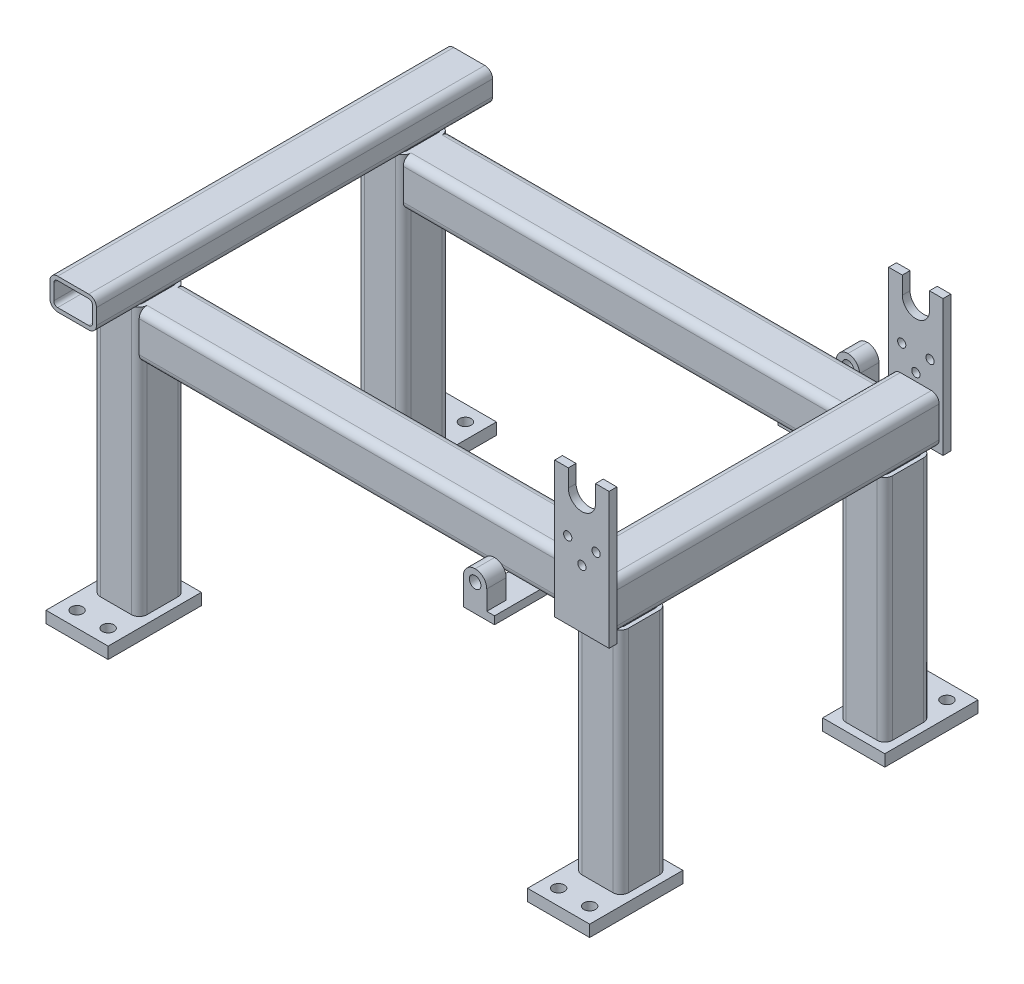
from build123d import *

# Parameters (mm, degrees)
BASE_EXTRUDE_THIN_DEPTH  = 266.7
SKETCH2_W                = 88.9
SKETCH2_H                = 222.25
BOSS_EXTRUDE1_DEPTH      = 12.7
BOSS_EXTRUDE_THIN1_DEPTH = 393.7
BOSS_EXTRUDE_THIN2_DEPTH = 711.2
SKETCH5_W                = 50.8
SKETCH5_H                = 127
BOSS_EXTRUDE3_DEPTH      = 12.7
SKETCH6_W                = 38.1
SKETCH6_H                = 31.75
BOSS_EXTRUDE4_DEPTH      = 50.8
FILLET1_R                = 19.05
CUT_EXTRUDE1_REACH       = 1035.203
SKETCH7_R                = 9.525
BOSS_EXTRUDE_THIN3_DEPTH = 457.2
BOSS_EXTRUDE_THIN4_DEPTH = 323.85
SKETCH10_W               = 101.6
SKETCH10_H               = 152.4
SKETCH10_R               = 9.525
BOSS_EXTRUDE6_DEPTH      = 19.05
SKETCH12_W               = 101.6
SKETCH12_H               = 152.4
SKETCH12_R               = 9.525
BOSS_EXTRUDE8_DEPTH      = 19.05
SKETCH13_R               = 6.7437
CUT_EXTRUDE2_DEPTH       = 1089.057259523
CUT_EXTRUDE3_DEPTH       = 1213.317946126


with BuildPart() as part:
    # Sketch1 → Base-Extrude-Thin (new body)
    with BuildSketch(Plane.XY):
        with BuildLine():
            Line((25.4, -165.1), (-25.4, -165.1))
            ThreePointArc((-25.4, -165.1), (-34.380256121, -168.819743879), (-38.1, -177.8))
            Line((-38.1, -177.8), (-38.1, -228.6))
            ThreePointArc((-38.1, -228.6), (-34.380256121, -237.580256121), (-25.4, -241.3))
            Line((-25.4, -241.3), (25.4, -241.3))
            ThreePointArc((25.4, -241.3), (34.380256121, -237.580256121), (38.1, -228.6))
            Line((38.1, -228.6), (38.1, -177.8))
            ThreePointArc((38.1, -177.8), (34.380256121, -168.819743879), (25.4, -165.1))
        make_face()
        with BuildLine():
            Line((25.4, -171.45), (-25.4, -171.45))
            ThreePointArc((-25.4, -171.45), (-29.890128061, -173.309871939), (-31.75, -177.8))
            Line((-31.75, -177.8), (-31.75, -228.6))
            ThreePointArc((-31.75, -228.6), (-29.890128061, -233.090128061), (-25.4, -234.95))
            Line((-25.4, -234.95), (25.4, -234.95))
            ThreePointArc((25.4, -234.95), (29.890128061, -233.090128061), (31.75, -228.6))
            Line((31.75, -228.6), (31.75, -177.8))
            ThreePointArc((31.75, -177.8), (29.890128061, -173.309871939), (25.4, -171.45))
        make_face(mode=Mode.SUBTRACT)
    extrude(amount=BASE_EXTRUDE_THIN_DEPTH)

    # Sketch2 → Boss-Extrude1 (add)
    with BuildSketch(Plane.XY.offset(266.7)):
        with Locations((0, -136.525)):
            Rectangle(SKETCH2_W, SKETCH2_H)
    extrude(amount=BOSS_EXTRUDE1_DEPTH)

    # Sketch3 → Boss-Extrude-Thin1 (add)
    with BuildSketch(Plane.XZ.offset(241.3)):
        with BuildLine():
            Line((25.4, 254), (-25.4, 254))
            ThreePointArc((-25.4, 254), (-34.380256121, 250.280256121), (-38.1, 241.3))
            Line((-38.1, 241.3), (-38.1, 190.5))
            ThreePointArc((-38.1, 190.5), (-34.380256121, 181.519743879), (-25.4, 177.8))
            Line((-25.4, 177.8), (25.4, 177.8))
            ThreePointArc((25.4, 177.8), (34.380256121, 181.519743879), (38.1, 190.5))
            Line((38.1, 190.5), (38.1, 241.3))
            ThreePointArc((38.1, 241.3), (34.380256121, 250.280256121), (25.4, 254))
        make_face()
        with BuildLine():
            Line((25.4, 247.65), (-25.4, 247.65))
            ThreePointArc((-25.4, 247.65), (-29.890128061, 245.790128061), (-31.75, 241.3))
            Line((-31.75, 241.3), (-31.75, 190.5))
            ThreePointArc((-31.75, 190.5), (-29.890128061, 186.009871939), (-25.4, 184.15))
            Line((-25.4, 184.15), (25.4, 184.15))
            ThreePointArc((25.4, 184.15), (29.890128061, 186.009871939), (31.75, 190.5))
            Line((31.75, 190.5), (31.75, 241.3))
            ThreePointArc((31.75, 241.3), (29.890128061, 245.790128061), (25.4, 247.65))
        make_face(mode=Mode.SUBTRACT)
    extrude(amount=BOSS_EXTRUDE_THIN1_DEPTH)

    # Sketch4 → Boss-Extrude-Thin2 (add)
    with BuildSketch(Plane(origin=(-38.1, 14.778510966, 30.648889912), x_dir=(0, 0, 1), z_dir=(-1, 0, 0))):
        with BuildLine():
            Line((210.651110088, -192.578510966), (159.851110088, -192.578510966))
            ThreePointArc((159.851110088, -192.578510966), (150.870853967, -196.298254845), (147.151110088, -205.278510966))
            Line((147.151110088, -205.278510966), (147.151110088, -256.078510966))
            ThreePointArc((147.151110088, -256.078510966), (150.870853967, -265.058767087), (159.851110088, -268.778510966))
            Line((159.851110088, -268.778510966), (210.651110088, -268.778510966))
            ThreePointArc((210.651110088, -268.778510966), (219.631366209, -265.058767087), (223.351110088, -256.078510966))
            Line((223.351110088, -256.078510966), (223.351110088, -205.278510966))
            ThreePointArc((223.351110088, -205.278510966), (219.631366209, -196.298254845), (210.651110088, -192.578510966))
        make_face()
        with BuildLine():
            Line((210.651110088, -198.928510966), (159.851110088, -198.928510966))
            ThreePointArc((159.851110088, -198.928510966), (155.360982027, -200.788382906), (153.501110088, -205.278510966))
            Line((153.501110088, -205.278510966), (153.501110088, -256.078510966))
            ThreePointArc((153.501110088, -256.078510966), (155.360982027, -260.568639027), (159.851110088, -262.428510966))
            Line((159.851110088, -262.428510966), (210.651110088, -262.428510966))
            ThreePointArc((210.651110088, -262.428510966), (215.141238148, -260.568639027), (217.001110088, -256.078510966))
            Line((217.001110088, -256.078510966), (217.001110088, -205.278510966))
            ThreePointArc((217.001110088, -205.278510966), (215.141238148, -200.788382906), (210.651110088, -198.928510966))
        make_face(mode=Mode.SUBTRACT)
    extrude(amount=BOSS_EXTRUDE_THIN2_DEPTH)

    # Sketch5 → Boss-Extrude3 (add)
    with BuildSketch(Plane.XZ.offset(254)):
        with Locations((-127, 257.175)):
            Rectangle(SKETCH5_W, SKETCH5_H)
    extrude(amount=BOSS_EXTRUDE3_DEPTH)

    # Sketch6 → Boss-Extrude4 (add)
    with BuildSketch(Plane(origin=(0, -254, 0), x_dir=(-1, 0, 0), z_dir=(0, 1, 0))):
        with Locations((133.35, 304.8)):
            Rectangle(SKETCH6_W, SKETCH6_H)
    extrude(amount=BOSS_EXTRUDE4_DEPTH)

    # Fillet1
    fillet1_edges = [part.edges().sort_by_distance(p)[0] for p in [
        (-114.3, -203.2, 304.8),
        (-152.4, -203.2, 304.8),
    ]]
    fillet(fillet1_edges, radius=FILLET1_R - 0.0001)  # a hair under: the kernel refuses the full size

    # Sketch7 → Cut-Extrude1 (cut, up to next)
    with BuildSketch(Plane.XY.offset(320.675), mode=Mode.PRIVATE) as cut_extrude1_sk1:
        with Locations((-133.35, -222.25)):
            Circle(SKETCH7_R)
    cut_extrude1_tool1 = extrude(cut_extrude1_sk1.sketch, amount=-CUT_EXTRUDE1_REACH, mode=Mode.PRIVATE) & part.part
    add(cut_extrude1_tool1.solids().sort_by_distance((-133.35, -222.25, 320.675))[0], mode=Mode.SUBTRACT)

    # Sketch8 → Boss-Extrude-Thin3 (add)
    with BuildSketch(Plane(origin=(0, -635, 0), x_dir=(-1, 0, 0), z_dir=(0, 1, 0))):
        with BuildLine():
            Line((812.8, 254), (762, 254))
            ThreePointArc((762, 254), (753.019743879, 250.280256121), (749.3, 241.3))
            Line((749.3, 241.3), (749.3, 190.5))
            ThreePointArc((749.3, 190.5), (753.019743879, 181.519743879), (762, 177.8))
            Line((762, 177.8), (812.8, 177.8))
            ThreePointArc((812.8, 177.8), (821.780256121, 181.519743879), (825.5, 190.5))
            Line((825.5, 190.5), (825.5, 241.3))
            ThreePointArc((825.5, 241.3), (821.780256121, 250.280256121), (812.8, 254))
        make_face()
        with BuildLine():
            Line((812.8, 247.65), (762, 247.65))
            ThreePointArc((762, 247.65), (757.50987194, 245.790128061), (755.65, 241.3))
            Line((755.65, 241.3), (755.65, 190.5))
            ThreePointArc((755.65, 190.5), (757.50987194, 186.009871939), (762, 184.15))
            Line((762, 184.15), (812.8, 184.15))
            ThreePointArc((812.8, 184.15), (817.290128061, 186.009871939), (819.15, 190.5))
            Line((819.15, 190.5), (819.15, 241.3))
            ThreePointArc((819.15, 241.3), (817.290128061, 245.790128061), (812.8, 247.65))
        make_face(mode=Mode.SUBTRACT)
    extrude(amount=BOSS_EXTRUDE_THIN3_DEPTH)

    # Sketch9 → Boss-Extrude-Thin4 (add)
    with BuildSketch(Plane.XY):
        with BuildLine():
            Line((-762, -127), (-812.8, -127))
            ThreePointArc((-812.8, -127), (-821.780256121, -130.719743879), (-825.5, -139.7))
            Line((-825.5, -139.7), (-825.5, -165.1))
            ThreePointArc((-825.5, -165.1), (-821.780256121, -174.080256121), (-812.8, -177.8))
            Line((-812.8, -177.8), (-762, -177.8))
            ThreePointArc((-762, -177.8), (-753.019743879, -174.080256121), (-749.3, -165.1))
            Line((-749.3, -165.1), (-749.3, -139.7))
            ThreePointArc((-749.3, -139.7), (-753.019743879, -130.719743879), (-762, -127))
        make_face()
        with BuildLine():
            Line((-762, -133.35), (-812.8, -133.35))
            ThreePointArc((-812.8, -133.35), (-817.290128061, -135.209871939), (-819.15, -139.7))
            Line((-819.15, -139.7), (-819.15, -165.1))
            ThreePointArc((-819.15, -165.1), (-817.290128061, -169.590128061), (-812.8, -171.45))
            Line((-812.8, -171.45), (-762, -171.45))
            ThreePointArc((-762, -171.45), (-757.50987194, -169.590128061), (-755.65, -165.1))
            Line((-755.65, -165.1), (-755.65, -139.7))
            ThreePointArc((-755.65, -139.7), (-757.50987194, -135.209871939), (-762, -133.35))
        make_face(mode=Mode.SUBTRACT)
    extrude(amount=BOSS_EXTRUDE_THIN4_DEPTH)

    # Sketch10 → Boss-Extrude6 (add)
    with BuildSketch(Plane.XZ.offset(635)):
        with Locations((0, 241.3)):
            Rectangle(SKETCH10_W, SKETCH10_H)
        with Locations(Location((25.4, 292.1, 0), (0, 0, 270))):
            Circle(SKETCH10_R, mode=Mode.SUBTRACT)
        with Locations(Location((-25.4, 292.1, 0), (0, 0, 270))):
            Circle(SKETCH10_R, mode=Mode.SUBTRACT)
    extrude(amount=-BOSS_EXTRUDE6_DEPTH)

    # Sketch12 → Boss-Extrude8 (add)
    with BuildSketch(Plane(origin=(-785.82546581, -635, 72.585205844), x_dir=(1, 0, 0), z_dir=(0, -1, 0))):
        with Locations((-1.57453419, 168.714794156)):
            Rectangle(SKETCH12_W, SKETCH12_H)
        with Locations(Location((23.82546581, 219.514794156, 0), (0, 0, 270))):
            Circle(SKETCH12_R, mode=Mode.SUBTRACT)
        with Locations(Location((-26.97453419, 219.514794156, 0), (0, 0, 270))):
            Circle(SKETCH12_R, mode=Mode.SUBTRACT)
    extrude(amount=-BOSS_EXTRUDE8_DEPTH)

    # Sketch13 → Cut-Extrude2 (cut, through all)
    with BuildSketch(Plane.XY.offset(279.4)):
        with Locations((0, -152.400762265)):
            Circle(SKETCH13_R)
        with Locations((-23.193810445, -122.174)):
            Circle(SKETCH13_R)
        with Locations((23.193810445, -122.174)):
            Circle(SKETCH13_R)
    extrude(amount=-CUT_EXTRUDE2_DEPTH, mode=Mode.SUBTRACT)

    # Boss-Mirror1: part across plane


with BuildPart() as part_1:
    add(part.part)
    add(part.part.mirror(Plane(origin=(25.4, -228.6, 0), x_dir=(1, 0, 0), z_dir=(0, 0, 1))))

    # Sketch14 → Cut-Extrude3 (cut, through all)
    with BuildSketch(Plane.XY.offset(279.4)):
        with BuildLine():
            Line((-22.225, -53.975), (-22.225, -25.4))
            Line((-22.225, -25.4), (22.225, -25.4))
            Line((22.225, -25.4), (22.225, -53.975))
            ThreePointArc((22.225, -53.975), (0, -76.2), (-22.225, -53.975))
        make_face()
    extrude(amount=-CUT_EXTRUDE3_DEPTH, mode=Mode.SUBTRACT)


solid = part_1.part
